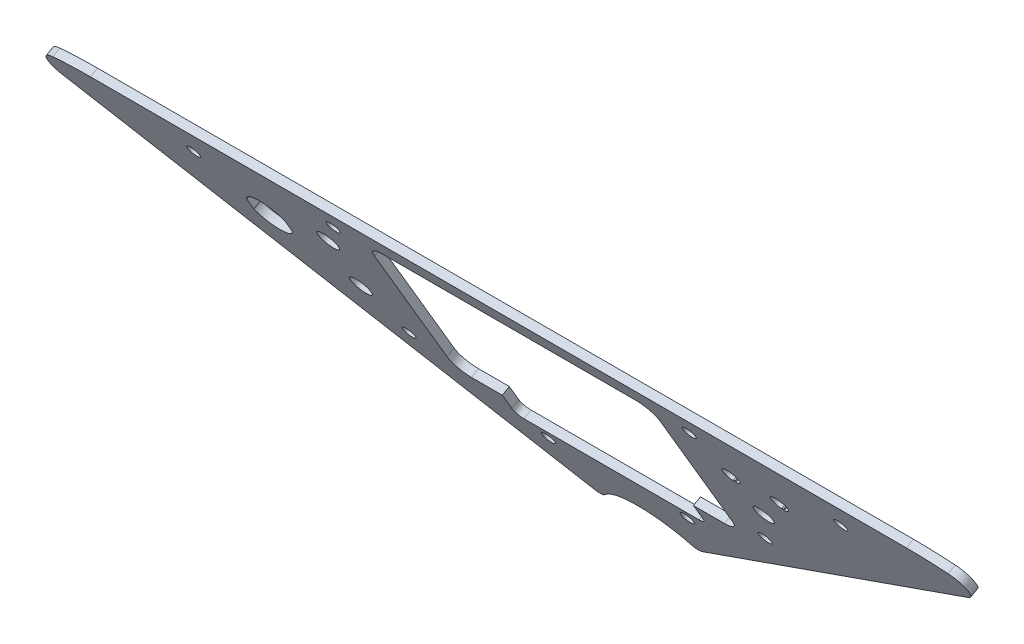
from build123d import *

# Parameters (mm, degrees)
SKETCH2_R           = 2.4892
BOSS_EXTRUDE1_DEPTH = 3.175
SKETCH4_R           = 2.4892
CUT_EXTRUDE1_DEPTH  = 919.047972743
SKETCH6_R           = 4
CUT_EXTRUDE3_DEPTH  = 919.045301638
CUT_EXTRUDE2_DEPTH  = 919.047972743
SKETCH7_R           = 3.75
CUT_EXTRUDE4_DEPTH  = 919.047972743
CUT_EXTRUDE5_DEPTH  = 919.047972743


with BuildPart() as part:
    # Sketch2 → Boss-Extrude1 (new body)
    with BuildSketch(Plane(origin=(0, -119.026177706, 202.518411263), x_dir=(-1, 0, 0), z_dir=(-7.267823095607155e-15, 0.506696551391541, -0.8621244717602671))):
        with BuildLine():
            Line((21.054229278, 782.405033139), (177.875467972, 885.559604741))
            ThreePointArc((177.875467972, 885.559604741), (180.62401835, 892.051058523), (175.684594577, 897.080531077))
            ThreePointArc((175.684594577, 897.080531077), (167.933410831, 898.287628232), (160.099198372, 898.691420443))
            Line((160.099198372, 898.691420443), (-160.099198372, 898.691420443))
            ThreePointArc((-160.099198372, 898.691420443), (-167.933410831, 898.287628232), (-175.684594577, 897.080531077))
            ThreePointArc((-175.684594577, 897.080531077), (-180.62401835, 892.051058523), (-177.875467972, 885.559604741))
            Line((-177.875467972, 885.559604741), (-21.054229278, 782.405033139))
            ThreePointArc((-21.054229278, 782.405033139), (-18.86350312, 781.91408365), (-16.895725938, 782.994900685))
            ThreePointArc((-16.895725938, 782.994900685), (0, 790.780888599), (16.895725938, 782.994900685))
            ThreePointArc((16.895725938, 782.994900685), (18.86350312, 781.91408365), (21.054229278, 782.405033139))
        make_face()
        with Locations((-127, 884.16502092)):
            Circle(SKETCH2_R, mode=Mode.SUBTRACT)
        with Locations((-27.242242795, 806.191391474)):
            Circle(SKETCH2_R, mode=Mode.SUBTRACT)
        with Locations((27.242242795, 806.191391474)):
            Circle(SKETCH2_R, mode=Mode.SUBTRACT)
        with Locations((127, 884.16502092)):
            Circle(SKETCH2_R, mode=Mode.SUBTRACT)
    extrude(amount=BOSS_EXTRUDE1_DEPTH)

    # Sketch4 → Cut-Extrude1 (cut, through all)
    with BuildSketch(Plane(origin=(0, -117.417416155, 199.781166065), x_dir=(-1, 0, 0), z_dir=(-7.267823095607155e-15, 0.506696551391541, -0.8621244717602671))):
        with Locations((-69.85, 888.753920404)):
            Circle(SKETCH4_R)
        with Locations((-69.85, 830.016420404)):
            Circle(SKETCH4_R)
        with Locations((69.85, 830.016420404)):
            Circle(SKETCH4_R)
        with Locations((69.85, 888.753920404)):
            Circle(SKETCH4_R)
    extrude(amount=-CUT_EXTRUDE1_DEPTH, mode=Mode.SUBTRACT)

    # Sketch6 → Cut-Extrude3 (cut, through all)
    with BuildSketch(Plane(origin=(0, -119.026177706, 202.518411263), x_dir=(1, 0, 0), z_dir=(7.267823095607155e-15, -0.506696551391541, 0.8621244717602671))):
        with Locations((-79.654, 873.291420443)):
            Circle(SKETCH6_R)
        with Locations((-79.654, 847.891420443)):
            Circle(SKETCH6_R)
    extrude(amount=-CUT_EXTRUDE3_DEPTH, mode=Mode.SUBTRACT)

    # Sketch5 → Cut-Extrude2 (cut, through all)
    with BuildSketch(Plane(origin=(0, -117.417416155, 199.781166065), x_dir=(-1, 0, 0), z_dir=(-7.267823095607155e-15, 0.506696551391541, -0.8621244717602671))):
        with BuildLine():
            Line((99.215659501, 862.570038261), (99.215659501, 868.137802624))
            ThreePointArc((99.215659501, 868.137802624), (106.715659501, 873.353920443), (114.215659501, 868.137802624))
            Line((114.215659501, 868.137802624), (114.215659501, 862.570038261))
            ThreePointArc((114.215659501, 862.570038261), (106.715659501, 857.353920443), (99.215659501, 862.570038261))
        make_face()
    extrude(amount=-CUT_EXTRUDE2_DEPTH, mode=Mode.SUBTRACT)

    # Sketch7 → Cut-Extrude4 (cut, through all)
    with BuildSketch(Plane(origin=(0, -117.417416155, 199.781166065), x_dir=(-1, 0, 0), z_dir=(-7.267823095607155e-15, 0.506696551391541, -0.8621244717602671))):
        with Locations((-80.15, 851.447670404)):
            Circle(SKETCH7_R)
        with BuildLine():
            Line((-77.2798, 867.260789436), (-77.2798, 867.957670404))
            Line((-77.2798, 867.957670404), (-76.6702, 867.957670404))
            Line((-76.6702, 867.957670404), (-76.6702, 867.260789436))
            ThreePointArc((-76.6702, 867.260789436), (-76.975, 873.748870404), (-77.2798, 867.260789436))
        make_face()
        with BuildLine():
            Line((-96.3298, 867.260789436), (-96.3298, 867.957670404))
            Line((-96.3298, 867.957670404), (-95.7202, 867.957670404))
            Line((-95.7202, 867.957670404), (-95.7202, 867.260789436))
            ThreePointArc((-95.7202, 867.260789436), (-96.025, 873.748870404), (-96.3298, 867.260789436))
        make_face()
    extrude(amount=-CUT_EXTRUDE4_DEPTH, mode=Mode.SUBTRACT)

    # Sketch8 → Cut-Extrude5 (cut, through all)
    with BuildSketch(Plane(origin=(0, -117.417416155, 199.781166065), x_dir=(-1, 0, 0), z_dir=(-7.267823095607155e-15, 0.506696551391541, -0.8621244717602671))):
        with BuildLine():
            Line((49.65, 890.428920482), (-49.65, 890.428920482))
            ThreePointArc((-49.65, 890.428920482), (-54.140128061, 888.569048542), (-56, 884.078920482))
            Line((-56, 884.078920482), (-56, 827.978920404))
            ThreePointArc((-56, 827.978920404), (-54.140128061, 823.488792343), (-49.65, 821.628920404))
            Line((-49.65, 821.628920404), (-37.5, 821.628920404))
            Line((-37.5, 821.628920404), (-37.5, 814.287420404))
            ThreePointArc((-37.5, 814.287420404), (-36.57006403, 812.042356374), (-34.325, 811.112420404))
            Line((-34.325, 811.112420404), (34.325, 811.112420404))
            ThreePointArc((34.325, 811.112420404), (36.57006403, 812.042356374), (37.5, 814.287420404))
            Line((37.5, 814.287420404), (37.5, 821.628920404))
            Line((37.5, 821.628920404), (49.65, 821.628920404))
            ThreePointArc((49.65, 821.628920404), (54.140128061, 823.488792343), (56, 827.978920404))
            Line((56, 827.978920404), (56, 884.078920482))
            ThreePointArc((56, 884.078920482), (54.140128061, 888.569048542), (49.65, 890.428920482))
        make_face()
    extrude(amount=-CUT_EXTRUDE5_DEPTH, mode=Mode.SUBTRACT)


solid = part.part
